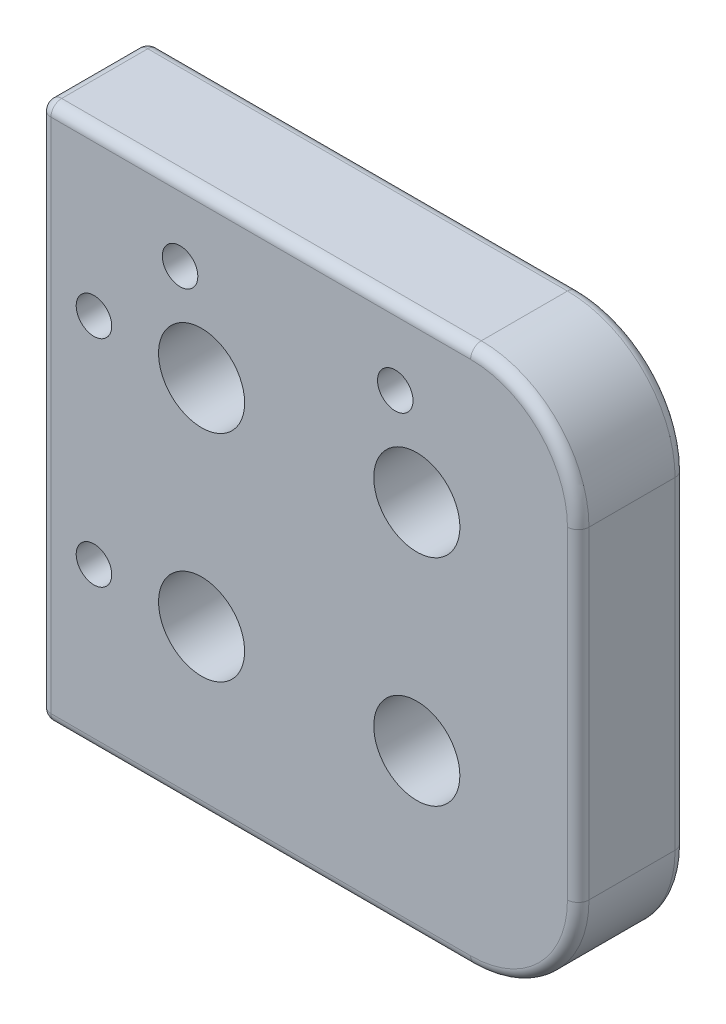
from build123d import *

# Parameters (mm, degrees)
SKETCH_1_W          = 50
SKETCH_1_H          = 50
EXTRUDE_1_DEPTH     = 10
FILLET_1_R          = 10
FILLET_2_R          = 1
SKETCH_3_R          = 4
CUT_EXTRUDE_2_DEPTH = 10
SKETCH_4_R          = 1.65
CUT_EXTRUDE_3_DEPTH = 10


with BuildPart() as part:
    # 草图1 → 凸台-拉伸1 (new body)
    with BuildSketch(Plane.XY):
        Rectangle(SKETCH_1_W, SKETCH_1_H)
    extrude(amount=EXTRUDE_1_DEPTH)

    # 圆角1
    fillet_1_edges = [part.edges().sort_by_distance(p)[0] for p in [
        (25, -25, 5),
        (25, 25, 5),
    ]]
    fillet(fillet_1_edges, radius=FILLET_1_R)

    # 圆角2
    fillet_2_edges = [part.edges().sort_by_distance(p)[0] for p in [
        (-5, -25, 0),
        (-5, -25, 10),
        (-25, 0, 0),
        (-5, 25, 0),
        (-5, 25, 10),
        (-25, 0, 10),
        (-25, -25, 5),
        (-25, 25, 5),
        (22.071067812, -22.071067812, 0),
        (25, 0, 0),
        (22.071067812, 22.071067812, 0),
        (22.071067812, -22.071067812, 10),
        (25, 0, 10),
        (22.071067812, 22.071067812, 10),
    ]]
    fillet(fillet_2_edges, radius=FILLET_2_R)

    # 草图3 → 切除-拉伸2 (cut)
    with BuildSketch(Plane.XY.offset(10)):
        with Locations((-10, 10)):
            Circle(SKETCH_3_R)
        with Locations((10, 10)):
            Circle(SKETCH_3_R)
        with Locations((10, -10)):
            Circle(SKETCH_3_R)
        with Locations((-10, -10)):
            Circle(SKETCH_3_R)
    extrude(amount=-CUT_EXTRUDE_2_DEPTH, mode=Mode.SUBTRACT)

    # 草图4 → 切除-拉伸3 (cut)
    with BuildSketch(Plane.XY.offset(10)):
        with Locations((-20, -10)):
            Circle(SKETCH_4_R)
        with Locations((-20, 10)):
            Circle(SKETCH_4_R)
        with Locations((-12, 18)):
            Circle(SKETCH_4_R)
        with Locations((8, 18)):
            Circle(SKETCH_4_R)
    extrude(amount=-CUT_EXTRUDE_3_DEPTH, mode=Mode.SUBTRACT)


solid = part.part
